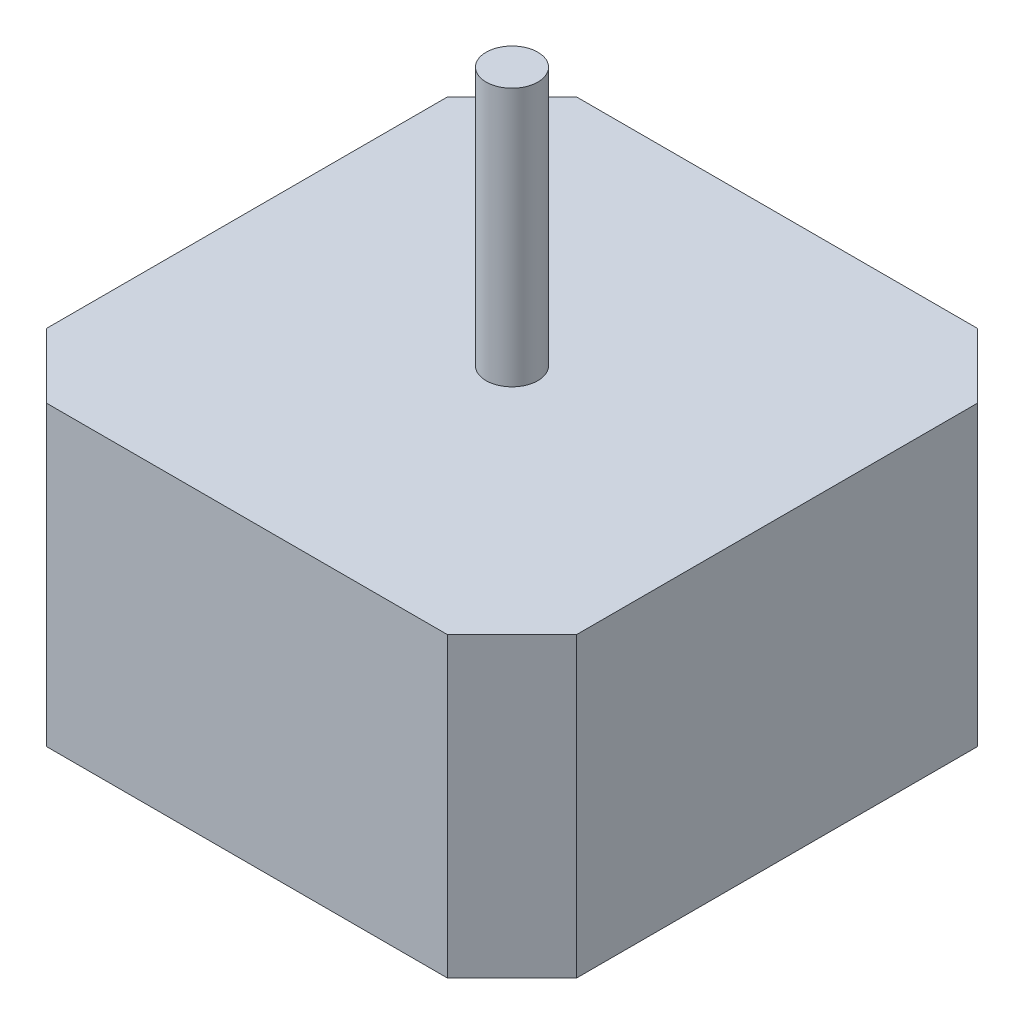
from build123d import *

# Parameters (mm, degrees)
BOSS_EXTRUDE7_DEPTH  = 23
CUT_EXTRUDE1_DEPTH   = 23
CUT_EXTRUDE3_DEPTH   = 23
SKETCH8_W            = 14.993938253
SKETCH8_H            = 4.00275912
CUT_EXTRUDE4_DEPTH   = 14
SKETCH3_R            = 2
BOSS_EXTRUDE11_DEPTH = 20


with BuildPart() as part:
    # Sketch2 → Boss-Extrude7 (new body)
    with BuildSketch(Plane(origin=(0, 0, 0), x_dir=(1, 0, 0), z_dir=(0, 1, 0))):
        Polygon((-7.484687163, 20.5), (-20.5, 20.5), (-20.5, -20.5), (20.5, -20.5), (20.5, 20.5), (7.50925109, 20.5), (7.50925109, 24.50275912), (-7.484687163, 24.50275912), align=None)
    extrude(amount=BOSS_EXTRUDE7_DEPTH)

    # Sketch6 → Cut-Extrude1 (cut)
    with BuildSketch(Plane(origin=(0, 0, 0), x_dir=(1, 0, 0), z_dir=(0, 1, 0))):
        Polygon((-20.5, 20.5), (-15.5, 20.5), (-20.5, 15.5), align=None)
    extrude(amount=CUT_EXTRUDE1_DEPTH, mode=Mode.SUBTRACT)

    # Sketch7 → Cut-Extrude3 (cut)
    with BuildSketch(Plane(origin=(0, 0, 0), x_dir=(1, 0, 0), z_dir=(0, 1, 0))):
        Polygon((-20.5, -20.5), (-20.5, -15.5), (-15.5, -20.5), align=None)
        Polygon((20.5, -20.5), (15.5, -20.5), (20.5, -15.5), align=None)
        Polygon((20.5, 20.5), (20.5, 15.5), (15.5, 20.5), align=None)
    extrude(amount=CUT_EXTRUDE3_DEPTH, mode=Mode.SUBTRACT)

    # Sketch8 → Cut-Extrude4 (cut)
    with BuildSketch(Plane(origin=(0, 23, 0), x_dir=(1, 0, 0), z_dir=(0, 1, 0))):
        with Locations((0.012281963, 22.50137956)):
            Rectangle(SKETCH8_W, SKETCH8_H)
    extrude(amount=-CUT_EXTRUDE4_DEPTH, mode=Mode.SUBTRACT)

    # Sketch3 → Boss-Extrude11 (add)
    with BuildSketch(Plane(origin=(0, 23, 0), x_dir=(1, 0, 0), z_dir=(0, 1, 0))):
        Circle(SKETCH3_R)
    extrude(amount=BOSS_EXTRUDE11_DEPTH)


solid = part.part
